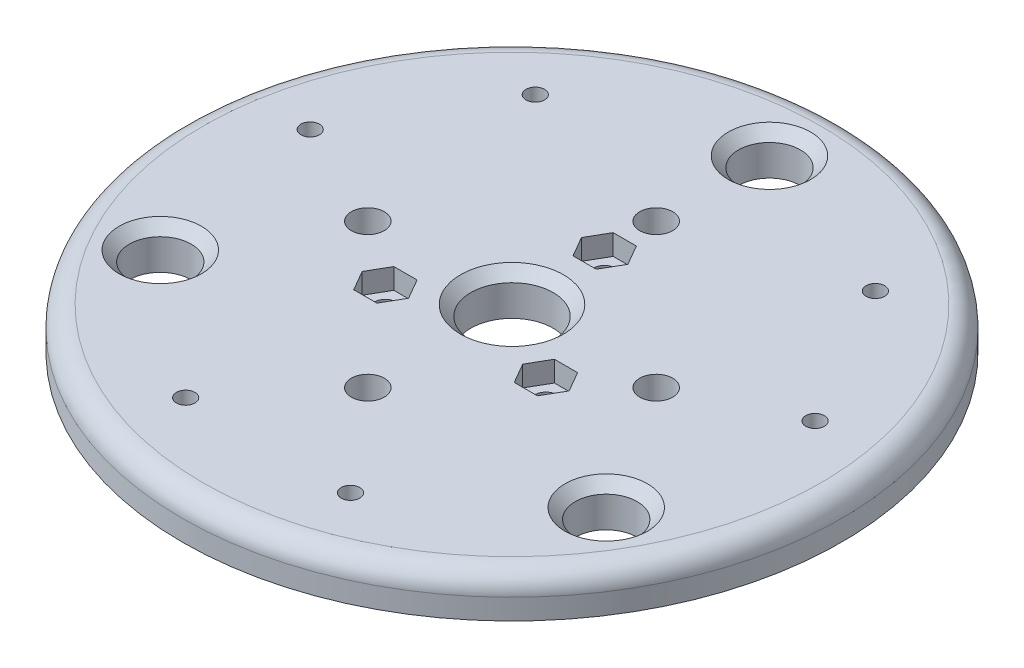
from build123d import *

# Parameters (mm, degrees)
SKETCH_1_R          = 32
SKETCH_1_R_2        = 4
SKETCH_1_R_3        = 3
EXTRUDE_1_DEPTH     = 4
FILLET_1_R          = 2
SKETCH_2_R          = 1.1
CUT_EXTRUDE_1_DEPTH = 46.431266766
SKETCH_3_R          = 1.6
CUT_EXTRUDE_2_DEPTH = 46.431266766
CUT_EXTRUDE_3_DEPTH = 2
CHAMFER_1_SIZE      = 1
SKETCH_5_R          = 0.9
CUT_EXTRUDE_4_DEPTH = 46.431266766


with BuildPart() as part:
    # Эскиз1 → Бобышка-Вытянуть1 (new body)
    with BuildSketch(Plane(origin=(0, 0, 0), x_dir=(1, 0, 0), z_dir=(0, 1, 0))):
        Circle(SKETCH_1_R)
        Circle(SKETCH_1_R_2, mode=Mode.SUBTRACT)
        with Locations((0, 25)):
            Circle(SKETCH_1_R_3, mode=Mode.SUBTRACT)
        with Locations((21.650635095, -12.5)):
            Circle(SKETCH_1_R_3, mode=Mode.SUBTRACT)
        with Locations((-21.650635095, -12.5)):
            Circle(SKETCH_1_R_3, mode=Mode.SUBTRACT)
    extrude(amount=EXTRUDE_1_DEPTH)

    # Скругление1
    fillet_1_edges = [part.edges().sort_by_distance(p)[0] for p in [
        (-32, 4, 0),
    ]]
    fillet(fillet_1_edges, radius=FILLET_1_R)

    # Эскиз2 → Вырез-Вытянуть1 (cut, through all)
    with BuildSketch(Plane(origin=(0, 4, 0), x_dir=(1, 0, 0), z_dir=(0, 1, 0))):
        with Locations((0, 9)):
            Circle(SKETCH_2_R)
        with Locations((7.794228634, -4.5)):
            Circle(SKETCH_2_R)
        with Locations((-7.794228634, -4.5)):
            Circle(SKETCH_2_R)
    extrude(amount=-CUT_EXTRUDE_1_DEPTH, mode=Mode.SUBTRACT)

    # Эскиз3 → Вырез-Вытянуть2 (cut, through all)
    with BuildSketch(Plane.XZ):
        with Locations((0, 14)):
            Circle(SKETCH_3_R)
        with Locations((14, 0)):
            Circle(SKETCH_3_R)
        with Locations((0, -14)):
            Circle(SKETCH_3_R)
        with Locations((-14, 0)):
            Circle(SKETCH_3_R)
    extrude(amount=-CUT_EXTRUDE_2_DEPTH, mode=Mode.SUBTRACT)

    # Эскиз4 → Вырез-Вытянуть3 (cut)
    with BuildSketch(Plane(origin=(0, 4, 0), x_dir=(1, 0, 0), z_dir=(0, 1, 0))):
        Polygon((5.542562584, -4.5), (6.668395609, -6.45), (8.920061659, -6.45), (10.045894684, -4.5), (8.920061659, -2.55), (6.668395609, -2.55), align=None)
        Polygon((1.125833025, 7.05), (2.25166605, 9), (1.125833025, 10.95), (-1.125833025, 10.95), (-2.25166605, 9), (-1.125833025, 7.05), align=None)
        Polygon((-6.668395609, -2.55), (-8.920061659, -2.55), (-10.045894684, -4.5), (-8.920061659, -6.45), (-6.668395609, -6.45), (-5.542562584, -4.5), align=None)
    extrude(amount=-CUT_EXTRUDE_3_DEPTH, mode=Mode.SUBTRACT)

    # Фаска1
    chamfer_1_edges = [part.edges().sort_by_distance(p)[0] for p in [
        (-3, 4, -25),
        (18.650635095, 4, 12.5),
        (-24.650635095, 4, 12.5),
        (-4, 4, 0),
    ]]
    chamfer(chamfer_1_edges, length=CHAMFER_1_SIZE)

    # Эскиз5 → Вырез-Вытянуть4 (cut, through all)
    with BuildSketch(Plane(origin=(0, 4, 0), x_dir=(1, 0, 0), z_dir=(0, 1, 0))):
        with Locations((-8, -23.685438565)):
            Circle(SKETCH_5_R)
        with Locations((8, -23.685438565)):
            Circle(SKETCH_5_R)
        with Locations((-16.512191497, 18.770922513)):
            Circle(SKETCH_5_R)
        with Locations((-24.512191497, 4.914516052)):
            Circle(SKETCH_5_R)
        with Locations((24.512191497, 4.914516052)):
            Circle(SKETCH_5_R)
        with Locations((16.512191497, 18.770922513)):
            Circle(SKETCH_5_R)
    extrude(amount=-CUT_EXTRUDE_4_DEPTH, mode=Mode.SUBTRACT)


solid = part.part
